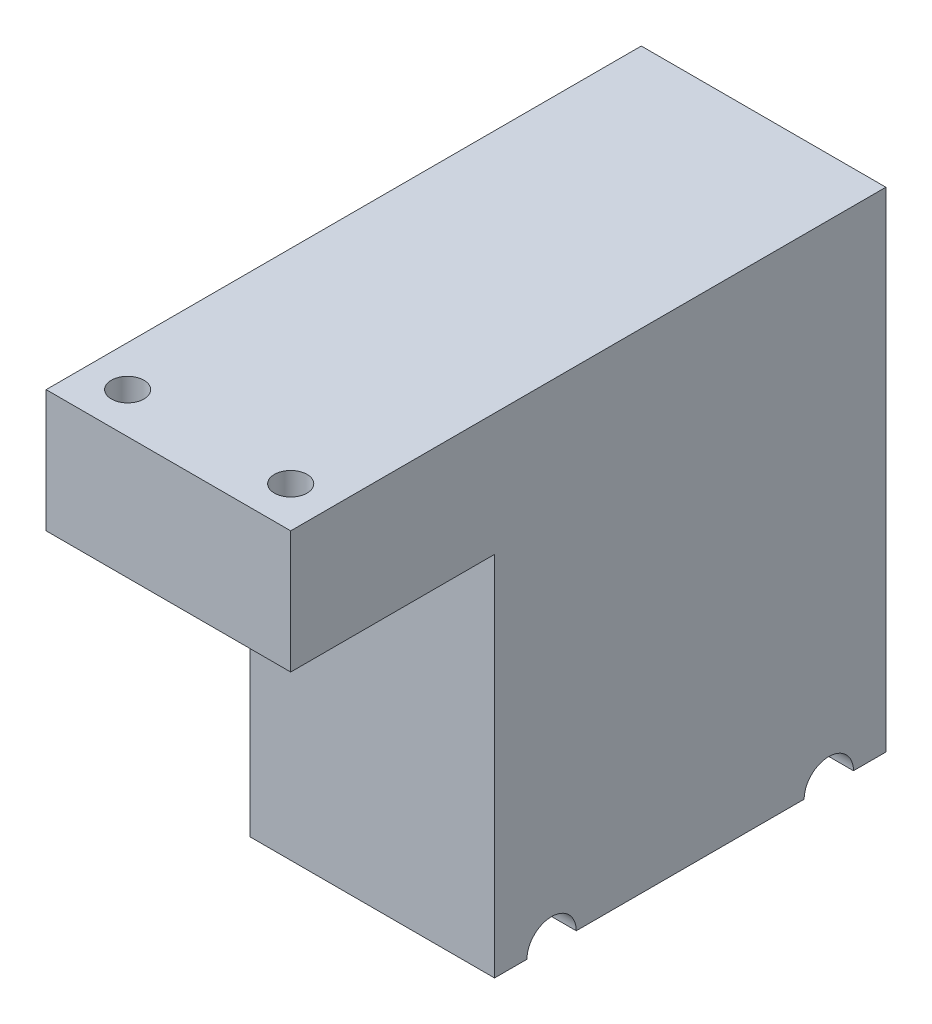
from build123d import *

# Parameters (mm, degrees)
SKETCH_1_W          = 30
SKETCH_1_H          = 95
EXTRUDE_1_DEPTH     = 48
SKETCH_2_R          = 3.025
SKETCH_2_R_2        = 3.005
CUT_EXTRUDE_1_DEPTH = 46
SKETCH_3_W          = 30
SKETCH_3_H          = 15
EXTRUDE_2_DEPTH     = 25
SKETCH_4_R          = 2
CUT_EXTRUDE_2_DEPTH = 5
SKETCH_5_W          = 48
SKETCH_5_H          = 35
CUT_EXTRUDE_3_DEPTH = 124.507084817
SKETCH_6_R          = 2
CUT_EXTRUDE_4_DEPTH = 5


with BuildPart() as part:
    # 草图1 → 凸台-拉伸1 (new body)
    with BuildSketch(Plane.XY):
        with Locations((15, 47.5)):
            Rectangle(SKETCH_1_W, SKETCH_1_H)
    extrude(amount=EXTRUDE_1_DEPTH)

    # 草图2 → 切除-拉伸1 (cut)
    # profile 1 of 2: a face of its own
    with BuildSketch(Plane.ZY):
        with Locations((7, 35)):
            Circle(SKETCH_2_R)
        with Locations((7, 35)):
            Circle(SKETCH_2_R_2, mode=Mode.SUBTRACT)
    # profile 2 of 2: a face of its own
    with BuildSketch(Plane.ZY):
        with Locations((41, 35)):
            Circle(SKETCH_2_R)
        with Locations((41, 35)):
            Circle(SKETCH_2_R_2, mode=Mode.SUBTRACT)
    extrude(amount=-CUT_EXTRUDE_1_DEPTH, mode=Mode.SUBTRACT)


with BuildPart() as cut_extrude_1_kept_piece:
    # of the separate pieces the step leaves, the one the design keeps (cut_extrude_1_pieces_kept)
    add(part.part.solids().sort_by_distance((0, 0, 0))[0])

    # 草图3 → 凸台-拉伸2 (add)
    with BuildSketch(Plane.XY.offset(48)):
        with Locations((15, 87.5)):
            Rectangle(SKETCH_3_W, SKETCH_3_H)
    extrude(amount=EXTRUDE_2_DEPTH)

    # 草图4 → 切除-拉伸2 (cut)
    with BuildSketch(Plane(origin=(0, 95, 0), x_dir=(1, 0, 0), z_dir=(0, 1, 0))):
        with Locations((5, -68)):
            Circle(SKETCH_4_R)
        with Locations((25, -68)):
            Circle(SKETCH_4_R)
    extrude(amount=-CUT_EXTRUDE_2_DEPTH, mode=Mode.SUBTRACT)

    # 草图5 → 切除-拉伸3 (cut, through all)
    with BuildSketch(Plane.ZY):
        with Locations((24, 17.5)):
            Rectangle(SKETCH_5_W, SKETCH_5_H)
    extrude(amount=-CUT_EXTRUDE_3_DEPTH, mode=Mode.SUBTRACT)

    # 草图6 → 切除-拉伸4 (cut)
    with BuildSketch(Plane.XZ.offset(-35)):
        with Locations((6, 31.975)):
            Circle(SKETCH_6_R)
        with Locations((24, 31.975)):
            Circle(SKETCH_6_R)
        with Locations((6, 16.025)):
            Circle(SKETCH_6_R)
        with Locations((24, 16.025)):
            Circle(SKETCH_6_R)
    extrude(amount=-CUT_EXTRUDE_4_DEPTH, mode=Mode.SUBTRACT)


solid = cut_extrude_1_kept_piece.part
